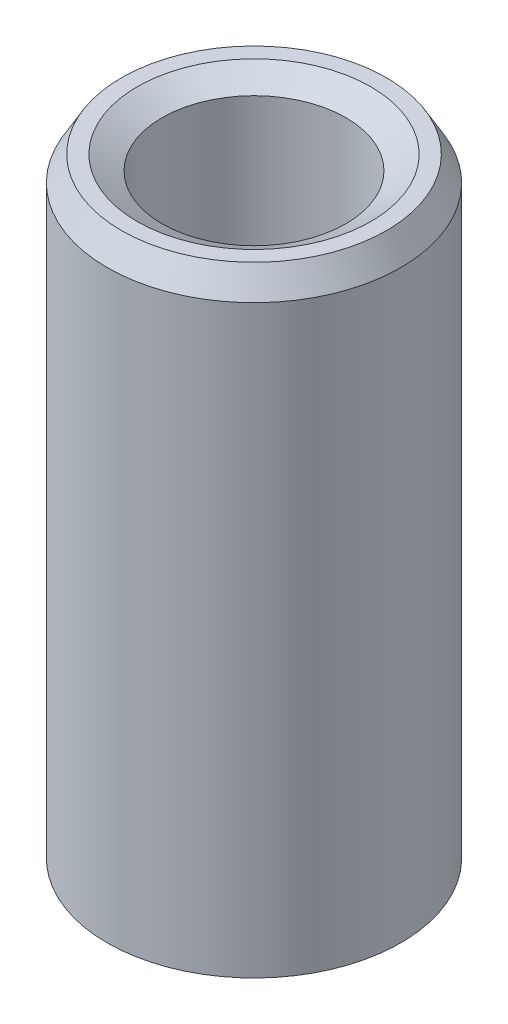
from build123d import *
from OCP.BRepFilletAPI import BRepFilletAPI_MakeChamfer

# Parameters (mm, degrees)
SKETCH1_R           = 17.5
BOSS_EXTRUDE1_DEPTH = 74.38159497
SKETCH2_R           = 10.957902318
CUT_EXTRUDE1_DEPTH  = 79.390826443
CHAMFER1_SIZE       = 2.96249922
CHAMFER1_SIZE2      = 1.710399722


with BuildPart() as part:
    # Sketch1 → Boss-Extrude1 (new body)
    with BuildSketch(Plane(origin=(0, 0, 0), x_dir=(1, 0, 0), z_dir=(0, 1, 0))):
        Circle(SKETCH1_R)
    extrude(amount=BOSS_EXTRUDE1_DEPTH)

    # Sketch2 → Cut-Extrude1 (cut, through all)
    with BuildSketch(Plane(origin=(0, 0, 0), x_dir=(1, 0, 0), z_dir=(0, 1, 0))):
        Circle(SKETCH2_R)
    extrude(amount=CUT_EXTRUDE1_DEPTH, mode=Mode.SUBTRACT)

    # Chamfer1: one chamfer whose edges measure the first distance from different faces: ONE call of the kernel's chamfer builder (chamfer() names one face for all edges)
    chamfer1_edges_1 = [part.edges().sort_by_distance(p)[0] for p in [
        (-10.957902318, 74.38159497, 0),
    ]]
    chamfer1_side_1 = [part.faces().sort_by_distance(p)[0] for p in [
        (-17.005025253, 74.38159497, 0),
    ]]
    chamfer1_edges_2 = [part.edges().sort_by_distance(p)[0] for p in [
        (-10.957902318, 0, 0),
    ]]
    chamfer1_side_2 = [part.faces().sort_by_distance(p)[0] for p in [
        (-10.957902318, 37.190797485, 0),
    ]]
    chamfer1_edges_3 = [part.edges().sort_by_distance(p)[0] for p in [
        (-17.5, 0, 0),
    ]]
    chamfer1_side_3 = [part.faces().sort_by_distance(p)[0] for p in [
        (-17.005025253, 0, 0),
    ]]
    chamfer1_edges_4 = [part.edges().sort_by_distance(p)[0] for p in [
        (-17.5, 74.38159497, 0),
    ]]
    chamfer1_side_4 = [part.faces().sort_by_distance(p)[0] for p in [
        (-17.5, 37.190797485, 0),
    ]]
    chamfer1 = BRepFilletAPI_MakeChamfer(part.part.solid().wrapped)
    for e in chamfer1_edges_1:
        chamfer1.Add(CHAMFER1_SIZE, CHAMFER1_SIZE2, e.wrapped, chamfer1_side_1[0].wrapped)  # the first distance lies on this face
    for e in chamfer1_edges_2:
        chamfer1.Add(CHAMFER1_SIZE, CHAMFER1_SIZE2, e.wrapped, chamfer1_side_2[0].wrapped)  # the first distance lies on this face
    for e in chamfer1_edges_3:
        chamfer1.Add(CHAMFER1_SIZE, CHAMFER1_SIZE2, e.wrapped, chamfer1_side_3[0].wrapped)  # the first distance lies on this face
    for e in chamfer1_edges_4:
        chamfer1.Add(CHAMFER1_SIZE, CHAMFER1_SIZE2, e.wrapped, chamfer1_side_4[0].wrapped)  # the first distance lies on this face
    add(Compound.cast(chamfer1.Shape()), mode=Mode.REPLACE)


solid = part.part
